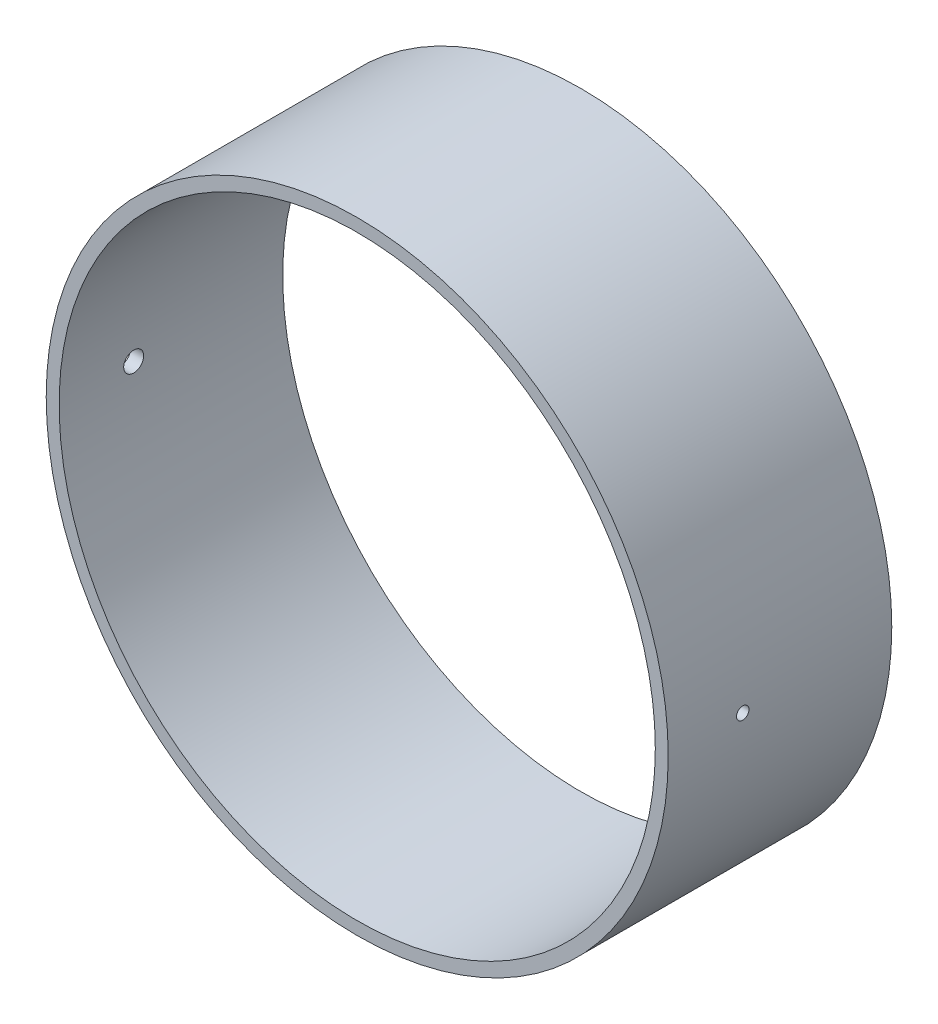
from build123d import *

# Parameters (mm, degrees)
SKETCH1_R           = 39.75
SKETCH1_R_2         = 38.1
BOSS_EXTRUDE1_DEPTH = 28.575
SKETCH2_R           = 1.27
CUT_EXTRUDE1_DEPTH  = 10
SKETCH3_R           = 0.79375
CUT_EXTRUDE2_DEPTH  = 94.364035659


with BuildPart() as part:
    # Sketch1 → Boss-Extrude1 (new body)
    with BuildSketch(Plane.XY):
        Circle(SKETCH1_R)
        Circle(SKETCH1_R_2, mode=Mode.SUBTRACT)
    extrude(amount=BOSS_EXTRUDE1_DEPTH)

    # Sketch2 → Cut-Extrude1 (cut)
    with BuildSketch(Plane.ZY.offset(39.75)):
        with Locations((19.05, 0)):
            Circle(SKETCH2_R)
    extrude(amount=-CUT_EXTRUDE1_DEPTH, mode=Mode.SUBTRACT)

    # Sketch3 → Cut-Extrude2 (cut, through all)
    with BuildSketch(Plane.ZY.offset(39.75)):
        with Locations((19.05, 0)):
            Circle(SKETCH3_R)
    extrude(amount=-CUT_EXTRUDE2_DEPTH, mode=Mode.SUBTRACT)


solid = part.part
